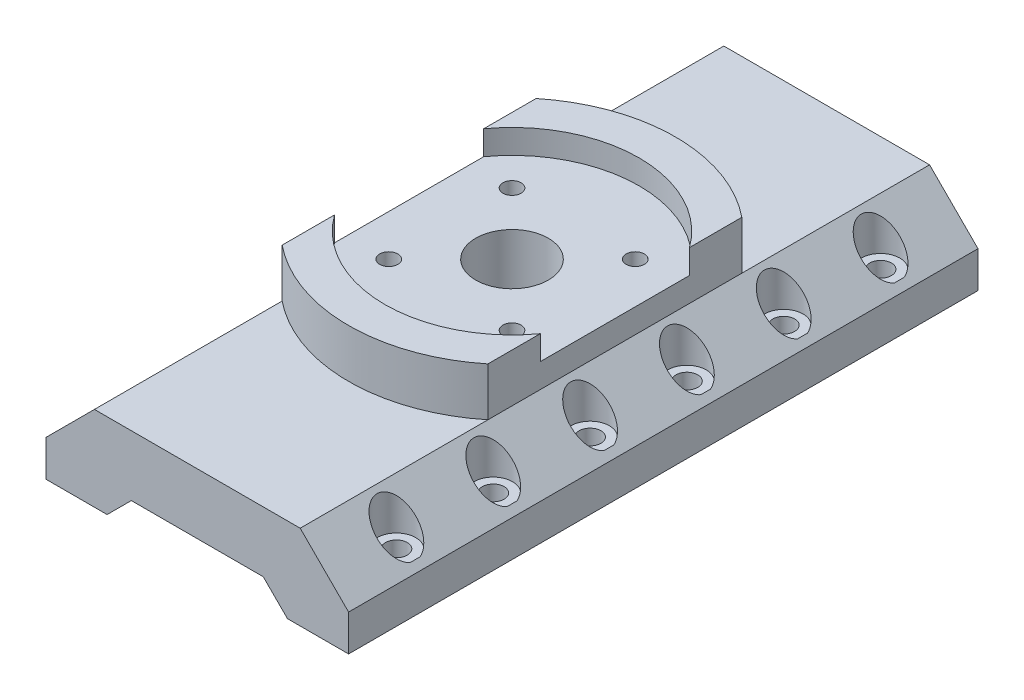
from build123d import *

# Parameters (mm, degrees)
SKETCH1_W           = 25
SKETCH1_H           = 52
BOSS_EXTRUDE1_DEPTH = 7
SKETCH2_R           = 0.9
CUT_EXTRUDE1_DEPTH  = 30.685855218
LPATTERN1_COUNT     = 6
LPATTERN1_PITCH     = 8
SKETCH9_R           = 1.875
SKETCH9_R_2         = 1.6
CUT_EXTRUDE3_DEPTH  = 3.5
LPATTERN2_COUNT     = 6
LPATTERN2_PITCH     = 8
CHAMFER2_SIZE       = 4
SKETCH10_W          = 14.9
SKETCH10_H          = 52
CUT_EXTRUDE4_DEPTH  = 2
CHAMFER3_SIZE       = 2
BOSS_EXTRUDE2_DEPTH = 2
BOSS_EXTRUDE3_DEPTH = 4
SKETCH13_R          = 0.75
CUT_EXTRUDE5_DEPTH  = 3
CUT_EXTRUDE6_REACH  = 31.466
SKETCH14_R          = 1.75
CUT_EXTRUDE7_REACH  = 32.22
SKETCH15_R          = 3


# Some blends are built 0.0001 mm under size
with BuildPart() as part:
    # Sketch1 → Boss-Extrude1 (new body)
    with BuildSketch(Plane(origin=(0, 0, 0), x_dir=(1, 0, 0), z_dir=(0, 1, 0))):
        Rectangle(SKETCH1_W, SKETCH1_H)
    extrude(amount=BOSS_EXTRUDE1_DEPTH)

    # Sketch2 → Cut-Extrude1 (cut, through all)
    with BuildSketch(Plane(origin=(0, 7, 0), x_dir=(1, 0, 0), z_dir=(0, 1, 0))):
        with Locations(Location((-10.45, -20, 0), (0, 0, 270))):
            Circle(SKETCH2_R)
        with Locations(Location((10.45, -20, 0), (0, 0, 270))):
            Circle(SKETCH2_R)
    cut_extrude1 = extrude(amount=-CUT_EXTRUDE1_DEPTH, mode=Mode.SUBTRACT)

    # LPattern1: Cut-Extrude1 ×6
    with Locations(*[(0, 0, -i * LPATTERN1_PITCH) for i in range(1, LPATTERN1_COUNT)]):
        add(cut_extrude1, mode=Mode.SUBTRACT)

    # Sketch9 → Cut-Extrude3 (cut)
    with BuildSketch(Plane(origin=(0, 7, 0), x_dir=(1, 0, 0), z_dir=(0, 1, 0))):
        with Locations(Location((-10.45, 20, 0), (0, 0, 270))):
            Circle(SKETCH9_R)
        with Locations(Location((10.45, 20, 0), (0, 0, 270))):
            Circle(SKETCH9_R_2)
    cut_extrude3 = extrude(amount=-CUT_EXTRUDE3_DEPTH, mode=Mode.SUBTRACT)

    # LPattern2: Cut-Extrude3 ×6
    with Locations(*[(0, 0, i * LPATTERN2_PITCH) for i in range(1, LPATTERN2_COUNT)]):
        add(cut_extrude3, mode=Mode.SUBTRACT)

    # Chamfer2
    # the kernel refuses this chamfer: 4 mm, written as the material it takes off along each edge
    with BuildSketch(Plane(origin=(-12.5, 7, -36.286731952), x_dir=(-0.027495876610586487, -0.9996219169112968, 0), z_dir=(0, 0, 1)), Plane(origin=(12.5, 7, 36.286731952), x_dir=(0.027495876610586487, -0.9996219169112968, 0), z_dir=(0, 0, -1))) as chamfer2_piece_1:
        Polygon((CHAMFER2_SIZE * 0.999621916911, CHAMFER2_SIZE * 0.0274958766106), (-CHAMFER2_SIZE * 0.0274958766106, CHAMFER2_SIZE * 0.999621916911), (0, 0), align=None)
    extrude(amount=72.573463904, mode=Mode.SUBTRACT)

    # Sketch10 → Cut-Extrude4 (cut)
    with BuildSketch(Plane.XZ):
        Rectangle(SKETCH10_W, SKETCH10_H)
    extrude(amount=-CUT_EXTRUDE4_DEPTH, mode=Mode.SUBTRACT)

    # Chamfer3
    chamfer3_edges = [part.edges().sort_by_distance(p)[0] for p in [
        (7.45, 2, 0),
        (-7.45, 2, 0),
    ]]
    chamfer(chamfer3_edges, length=CHAMFER3_SIZE - 0.0001)  # a hair under: the kernel refuses the full size

    # Sketch12 → Boss-Extrude2 (add)
    with BuildSketch(Plane(origin=(0, 7, 0), x_dir=(1, 0, 0), z_dir=(0, 1, 0))):
        with BuildLine():
            ThreePointArc((8.5, 6.164414003), (0, 10.5), (-8.5, 6.164414003))
            Line((-8.5, 6.164414003), (-8.5, -6.164414003))
            ThreePointArc((-8.5, -6.164414003), (0, -10.5), (8.5, -6.164414003))
            Line((8.5, -6.164414003), (8.5, 6.164414003))
        make_face()
    extrude(amount=BOSS_EXTRUDE2_DEPTH)

    # Sketch12<3> → Boss-Extrude3 (add)
    with BuildSketch(Plane(origin=(0, 7, 0), x_dir=(1, 0, 0), z_dir=(0, 1, 0))):
        with BuildLine():
            ThreePointArc((8.5, 10.488088482), (0, 13.5), (-8.5, 10.488088482))
            Line((-8.5, 10.488088482), (-8.5, 6.164414003))
            ThreePointArc((-8.5, 6.164414003), (0, 10.5), (8.5, 6.164414003))
            Line((8.5, 6.164414003), (8.5, 10.488088482))
        make_face()
        with BuildLine():
            Line((-8.5, -6.164414003), (-8.5, -10.488088482))
            ThreePointArc((-8.5, -10.488088482), (0, -13.5), (8.5, -10.488088482))
            Line((8.5, -10.488088482), (8.5, -6.164414003))
            ThreePointArc((8.5, -6.164414003), (0, -10.5), (-8.5, -6.164414003))
        make_face()
    extrude(amount=BOSS_EXTRUDE3_DEPTH)

    # Sketch13 → Cut-Extrude5 (cut)
    with BuildSketch(Plane(origin=(0, 9, 0), x_dir=(1, 0, 0), z_dir=(0, 1, 0))):
        with Locations(Location((-5.091168825, 5.091168825, 0), (0, 0, 270))):
            Circle(SKETCH13_R)
        with Locations(Location((5.091168825, 5.091168825, 0), (0, 0, 270))):
            Circle(SKETCH13_R)
        with Locations(Location((5.091168825, -5.091168825, 0), (0, 0, 270))):
            Circle(SKETCH13_R)
        with Locations(Location((-5.091168825, -5.091168825, 0), (0, 0, 270))):
            Circle(SKETCH13_R)
    extrude(amount=-CUT_EXTRUDE5_DEPTH, mode=Mode.SUBTRACT)

    # Sketch14 → Cut-Extrude6 (cut, up to next)
    with BuildSketch(Plane(origin=(0, 6, 0), x_dir=(1, 0, 0), z_dir=(0, 1, 0)), mode=Mode.PRIVATE) as cut_extrude6_sk1:
        with Locations(Location((-5.091168825, 5.091168825, 0), (0, 0, 270))):
            Circle(SKETCH14_R)
    cut_extrude6_tool1 = extrude(cut_extrude6_sk1.sketch, amount=-CUT_EXTRUDE6_REACH, mode=Mode.PRIVATE) & part.part
    # Sketch14 → Cut-Extrude6 (cut, up to next)
    with BuildSketch(Plane(origin=(0, 6, 0), x_dir=(1, 0, 0), z_dir=(0, 1, 0)), mode=Mode.PRIVATE) as cut_extrude6_sk2:
        with Locations(Location((5.091168825, 5.091168825, 0), (0, 0, 270))):
            Circle(SKETCH14_R)
    cut_extrude6_tool2 = extrude(cut_extrude6_sk2.sketch, amount=-CUT_EXTRUDE6_REACH, mode=Mode.PRIVATE) & part.part
    # Sketch14 → Cut-Extrude6 (cut, up to next)
    with BuildSketch(Plane(origin=(0, 6, 0), x_dir=(1, 0, 0), z_dir=(0, 1, 0)), mode=Mode.PRIVATE) as cut_extrude6_sk3:
        with Locations(Location((5.091168825, -5.091168825, 0), (0, 0, 270))):
            Circle(SKETCH14_R)
    cut_extrude6_tool3 = extrude(cut_extrude6_sk3.sketch, amount=-CUT_EXTRUDE6_REACH, mode=Mode.PRIVATE) & part.part
    # Sketch14 → Cut-Extrude6 (cut, up to next)
    with BuildSketch(Plane(origin=(0, 6, 0), x_dir=(1, 0, 0), z_dir=(0, 1, 0)), mode=Mode.PRIVATE) as cut_extrude6_sk4:
        with Locations(Location((-5.091168825, -5.091168825, 0), (0, 0, 270))):
            Circle(SKETCH14_R)
    cut_extrude6_tool4 = extrude(cut_extrude6_sk4.sketch, amount=-CUT_EXTRUDE6_REACH, mode=Mode.PRIVATE) & part.part
    add(cut_extrude6_tool1.solids().sort_by_distance((-5.091169, 6, -5.091169))[0], mode=Mode.SUBTRACT)
    add(cut_extrude6_tool2.solids().sort_by_distance((5.091169, 6, -5.091169))[0], mode=Mode.SUBTRACT)
    add(cut_extrude6_tool3.solids().sort_by_distance((5.091169, 6, 5.091169))[0], mode=Mode.SUBTRACT)
    add(cut_extrude6_tool4.solids().sort_by_distance((-5.091169, 6, 5.091169))[0], mode=Mode.SUBTRACT)

    # Sketch15 → Cut-Extrude7 (cut, up to next)
    with BuildSketch(Plane(origin=(0, 9, 0), x_dir=(1, 0, 0), z_dir=(0, 1, 0)), mode=Mode.PRIVATE) as cut_extrude7_sk1:
        with Locations(Location((0, 0, 0), (0, 0, 270))):
            Circle(SKETCH15_R)
    cut_extrude7_tool1 = extrude(cut_extrude7_sk1.sketch, amount=-CUT_EXTRUDE7_REACH, mode=Mode.PRIVATE) & part.part
    add(cut_extrude7_tool1.solids().sort_by_distance((0, 9, 0))[0], mode=Mode.SUBTRACT)


solid = part.part
